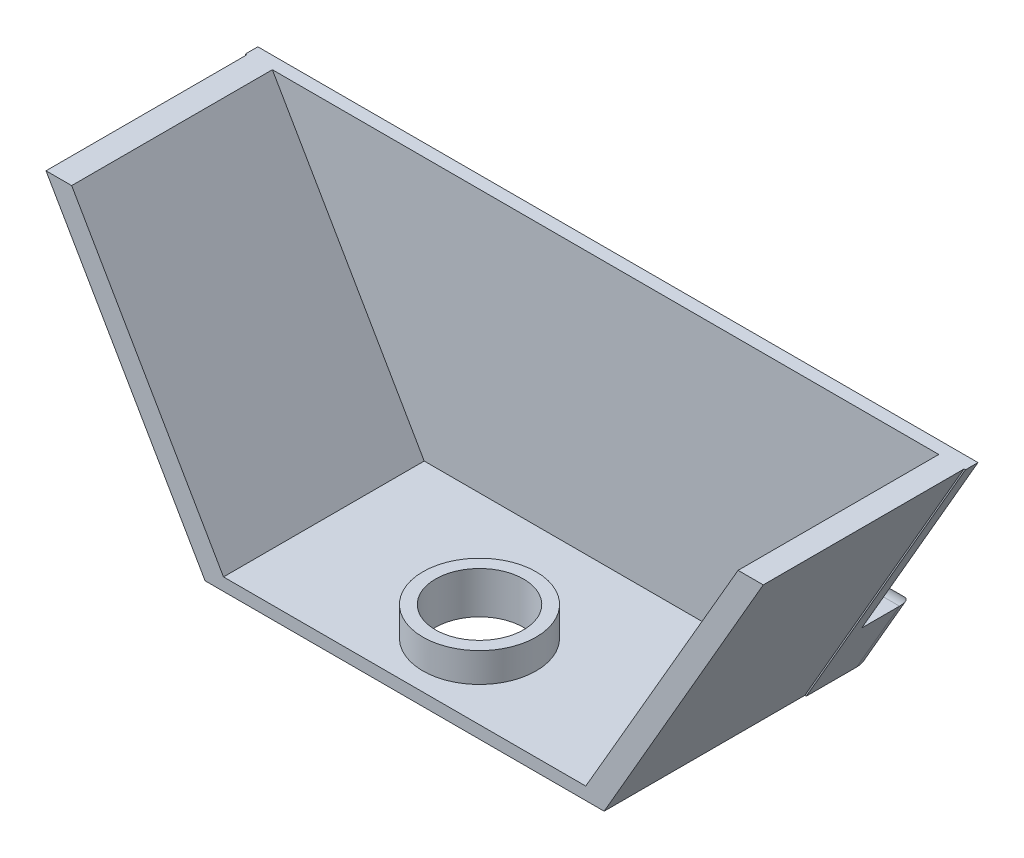
from build123d import *

# Parameters (mm, degrees)
BOSS_EXTRUDE1_DEPTH = 1
BOSS_EXTRUDE2_DEPTH = 5
FILLET1_R           = 2
BOSS_EXTRUDE3_DEPTH = 15.95
SKETCH10_R          = 4.5
SKETCH10_R_2        = 3.5
BOSS_EXTRUDE7_DEPTH = 2.33
CUT_EXTRUDE1_START  = -1
SKETCH13_R          = 3.5
CUT_EXTRUDE1_DEPTH  = 1


with BuildPart() as part:
    # Sketch1 → Boss-Extrude1 (new body)
    with BuildSketch(Plane.XY):
        Polygon((86.661024886, 23.401143993), (29.430818123, 23.401143993), (42.074789018, 1.501143993), (74.017053991, 1.501143993), align=None)
    extrude(amount=BOSS_EXTRUDE1_DEPTH)

    # Sketch2 → Boss-Extrude2 (add)
    with BuildSketch(Plane(origin=(0, 0, 0), x_dir=(-1, 0, 0), z_dir=(0, 0, -1))):
        Polygon((-74.017053991, 1.501143993), (-71.117053991, 1.501143993), (-71.117053991, 7.401143993), (-77.423420579, 7.401143993), align=None)
        Polygon((-42.074789018, 1.501143993), (-44.974789018, 1.501143993), (-44.974789018, 7.401143993), (-38.66842243, 7.401143993), align=None)
    extrude(amount=BOSS_EXTRUDE2_DEPTH)

    # Fillet1
    # the kernel refuses this fillet: 2 mm, written as the material it takes off along each edge
    with BuildSketch(Plane(origin=(44.974789018, -3.498856007, -5), x_dir=(-1, 0, 0), z_dir=(0, 1, 0)), Plane(origin=(71.117053991, -3.498856007, -5), x_dir=(0, 0, 1), z_dir=(0, 1, 0))) as fillet1_piece_1:
        with BuildLine():
            CenterArc((FILLET1_R, FILLET1_R), FILLET1_R, 180, 90)
            Line((0, FILLET1_R), (0, 0))
            Line((0, 0), (FILLET1_R, 0))
        make_face()
    extrude(amount=15.9, mode=Mode.SUBTRACT)
    with BuildSketch(Plane(origin=(49.974789018, 7.401143993, -5), x_dir=(0, -1, 0), z_dir=(-1, 0, 0)), Plane(origin=(66.117053991, 7.401143993, -5), x_dir=(0, 0, 1), z_dir=(1, 0, 0))) as fillet1_piece_2:
        with BuildLine():
            CenterArc((FILLET1_R, FILLET1_R), FILLET1_R, 180, 90)
            Line((0, FILLET1_R), (0, 0))
            Line((0, 0), (FILLET1_R, 0))
        make_face()
    extrude(amount=16.306366588, mode=Mode.SUBTRACT)
    with BuildSketch(Plane(origin=(36.16842243, 11.731271012, -5), x_dir=(0.8660254037844386, 0.5000000000000002, 0), z_dir=(0.5000000000000002, -0.8660254037844386, 0))) as fillet1_piece_3:
        with BuildLine():
            CenterArc((FILLET1_R, FILLET1_R), FILLET1_R, 180, 90)
            Line((0, FILLET1_R), (0, 0))
            Line((0, 0), (FILLET1_R, 0))
        make_face()
    extrude(amount=16.812733176, mode=Mode.SUBTRACT)
    with BuildSketch(Plane(origin=(79.923420579, 11.731271012, -5), x_dir=(-0.866025403784438, 0.500000000000001, 0), z_dir=(-0.500000000000001, -0.8660254037844382, 0))) as fillet1_piece_4:
        with BuildLine():
            CenterArc((FILLET1_R, -FILLET1_R), FILLET1_R, 90, 90)
            Line((0, -FILLET1_R), (0, 0))
            Line((0, 0), (FILLET1_R, 0))
        make_face()
    extrude(amount=16.812733176, mode=Mode.SUBTRACT)

    # Sketch4 → Boss-Extrude3 (add)
    with BuildSketch(Plane.XY.offset(1)):
        Polygon((42.190259072, 1.501143993), (73.901583937, 1.501143993), (86.545554832, 23.401143993), (84.545554832, 23.401143993), (72.439703722, 2.501143993), (43.652139287, 2.501143993), (31.585518661, 23.401143993), (29.546288176, 23.401143993), align=None)
    extrude(amount=BOSS_EXTRUDE3_DEPTH)

    # Sketch10 → Boss-Extrude7 (add)
    with BuildSketch(Plane(origin=(0, 2.501143993, 0), x_dir=(1, 0, 0), z_dir=(0, 1, 0))):
        with Locations((58.045921504, -11)):
            Circle(SKETCH10_R)
        with Locations(Location((58.045921504, -11, 0), (0, 0, 180))):
            Circle(SKETCH10_R_2, mode=Mode.SUBTRACT)
    extrude(amount=BOSS_EXTRUDE7_DEPTH)

    # Sketch13 → Cut-Extrude1 (cut)
    with BuildSketch(Plane(origin=(0, 2.501143993, 0), x_dir=(1, 0, 0), z_dir=(0, 1, 0)).offset(CUT_EXTRUDE1_START)):
        with Locations(Location((58.045921504, -11, 0), (0, 0, 180))):
            Circle(SKETCH13_R)
    extrude(amount=CUT_EXTRUDE1_DEPTH, mode=Mode.SUBTRACT)


solid = part.part
